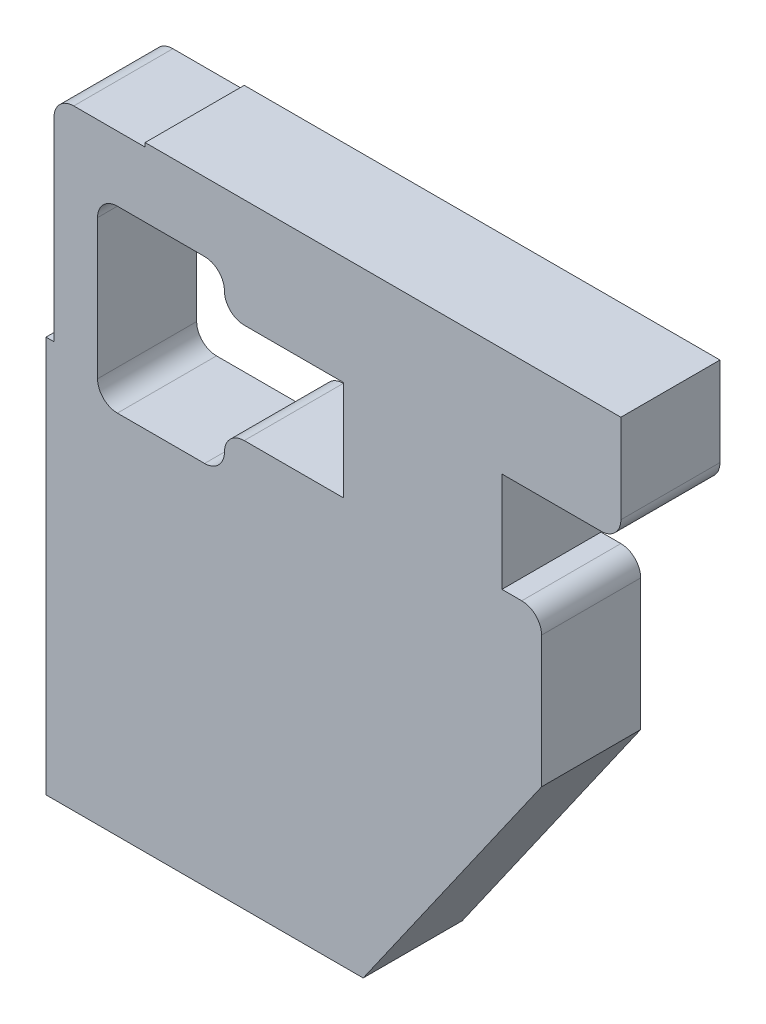
from build123d import *

# Parameters (mm, degrees)
BOSS_EXTRUDE1_DEPTH = 0.125
FILLET1_R           = 0.05


with BuildPart() as part:
    # frame_outline → Boss-Extrude1 (new, symmetric)
    with BuildSketch(Plane.XY):
        Polygon((0.3, -0.05), (1.5, -0.05), (1.5, -0.324), (1.2, -0.324), (1.2, -0.576), (1.3, -0.576), (1.3, -0.957333397), (0.85, -1.6), (0.05, -1.6), (0.05, -0.6), (0.07, -0.6), (0.07, -0.06), (0.3, -0.06), align=None)
        Polygon((0.5, -0.324), (0.8, -0.324), (0.8, -0.576), (0.5, -0.576), (0.5, -0.676), (0.18, -0.676), (0.18, -0.224), (0.5, -0.224), align=None, mode=Mode.SUBTRACT)
    extrude(amount=BOSS_EXTRUDE1_DEPTH, both=True)

    # Fillet1
    fillet1_edges = [part.edges().sort_by_distance(p)[0] for p in [
        (1.3, -0.576, 0),
        (1.5, -0.324, 0),
        (0.5, -0.324, 0),
        (0.5, -0.576, 0),
        (0.5, -0.676, 0),
        (0.18, -0.676, 0),
        (0.5, -0.224, 0),
        (0.18, -0.224, 0),
        (0.07, -0.06, 0),
    ]]
    fillet(fillet1_edges, radius=FILLET1_R - 0.0001)  # a hair under: the kernel refuses the full size


solid = part.part
